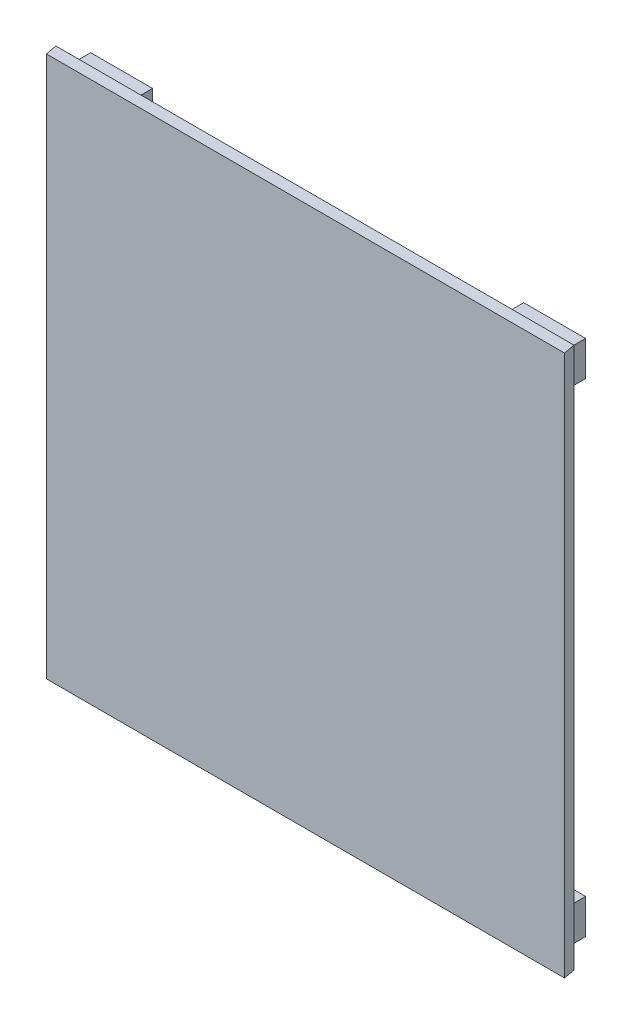
from build123d import *

# Parameters (mm, degrees)
SKETCH1_W                 = 67.008250425
SKETCH1_H                 = 70
BOSS_EXTRUDE1_DEPTH       = 1.5
BOSS_EXTRUDE2_START       = -9.75
BOSS_EXTRUDE2_DEPTH       = 70
CUT_EXTRUDE1_START        = -6
CUT_EXTRUDE1_OUTLINE_W    = 73
CUT_EXTRUDE1_OUTLINE_H    = 4
CUT_EXTRUDE1_DEPTH        = 1.741494861
SKETCH4_W                 = 8
SKETCH4_H                 = 4.5
SKETCH4_W_2               = 5
SKETCH4_H_2               = 1.5
BOSS_EXTRUDE3_DEPTH       = 3
MIRROR2_COPY_1_SKETCH_W   = 8
MIRROR2_COPY_1_SKETCH_H   = 4.5
MIRROR2_COPY_1_SKETCH_W_2 = 5
MIRROR2_COPY_1_SKETCH_H_2 = 1.5
MIRROR2_COPY_1_DEPTH      = 3


with BuildPart() as part:
    # Sketch1 → Boss-Extrude1 (new body)
    with BuildSketch(Plane.XY):
        with Locations((29.175646202, 25.25)):
            Rectangle(SKETCH1_W, SKETCH1_H)
    extrude(amount=BOSS_EXTRUDE1_DEPTH)

    # Boss-Extrude2: read off the stored shape, not the designer's step
    # Boss-Extrude2 outline → Boss-Extrude2 (add)
    with BuildSketch(Plane(origin=(0, 0, 0), x_dir=(1, 0, 0), z_dir=(0, 1, 0)).offset(BOSS_EXTRUDE2_START)):
        Polygon((62.952808957, -1.5), (62.679771414, 0), (62.679771414, -1.5), align=None)
    extrude(amount=BOSS_EXTRUDE2_DEPTH)

    # Cut-Extrude1: read off the stored shape, not the designer's step
    # Cut-Extrude1 outline → Cut-Extrude1 (cut)
    with BuildSketch(Plane(origin=(0, 0, 0), x_dir=(0, 1, 0), z_dir=(0.9838340738940914, 0, -0.17908242528220206)).offset(CUT_EXTRUDE1_START)):
        with Locations((25.5, 0)):
            Rectangle(CUT_EXTRUDE1_OUTLINE_W, CUT_EXTRUDE1_OUTLINE_H)
    extrude(amount=CUT_EXTRUDE1_DEPTH, mode=Mode.SUBTRACT)

    # Sketch4 → Boss-Extrude3 (add)
    with BuildSketch(Plane(origin=(0, 0, 0), x_dir=(-1, 0, 0), z_dir=(0, 0, -1))):
        with Locations((-1.171520989, 56.5)):
            Rectangle(SKETCH4_W, SKETCH4_H)
        with Locations((-1.171520989, 56.5)):
            Rectangle(SKETCH4_W_2, SKETCH4_H_2, mode=Mode.SUBTRACT)
    boss_extrude3 = extrude(amount=BOSS_EXTRUDE3_DEPTH)

    # Mirror1: Boss-Extrude3 across plane
    add(boss_extrude3.mirror(Plane(origin=(29.175646202, 0, 0), x_dir=(0, 0, 1), z_dir=(1, 0, 0))))

    # Mirror2: Boss-Extrude3 across plane
    add(boss_extrude3.mirror(Plane(origin=(0, 25.25, 0), x_dir=(0, 0, 1), z_dir=(0, -1, 0))))

    # Mirror2 copy 1 sketch → Mirror2 copy 1 (add)
    with BuildSketch(Plane(origin=(58.351292403, 50.5, 0), x_dir=(1, 0, 0), z_dir=(0, 0, -1))):
        with Locations((-1.171520989, 56.5)):
            Rectangle(MIRROR2_COPY_1_SKETCH_W, MIRROR2_COPY_1_SKETCH_H)
        with Locations((-1.171520989, 56.5)):
            Rectangle(MIRROR2_COPY_1_SKETCH_W_2, MIRROR2_COPY_1_SKETCH_H_2, mode=Mode.SUBTRACT)
    extrude(amount=MIRROR2_COPY_1_DEPTH)


solid = part.part
